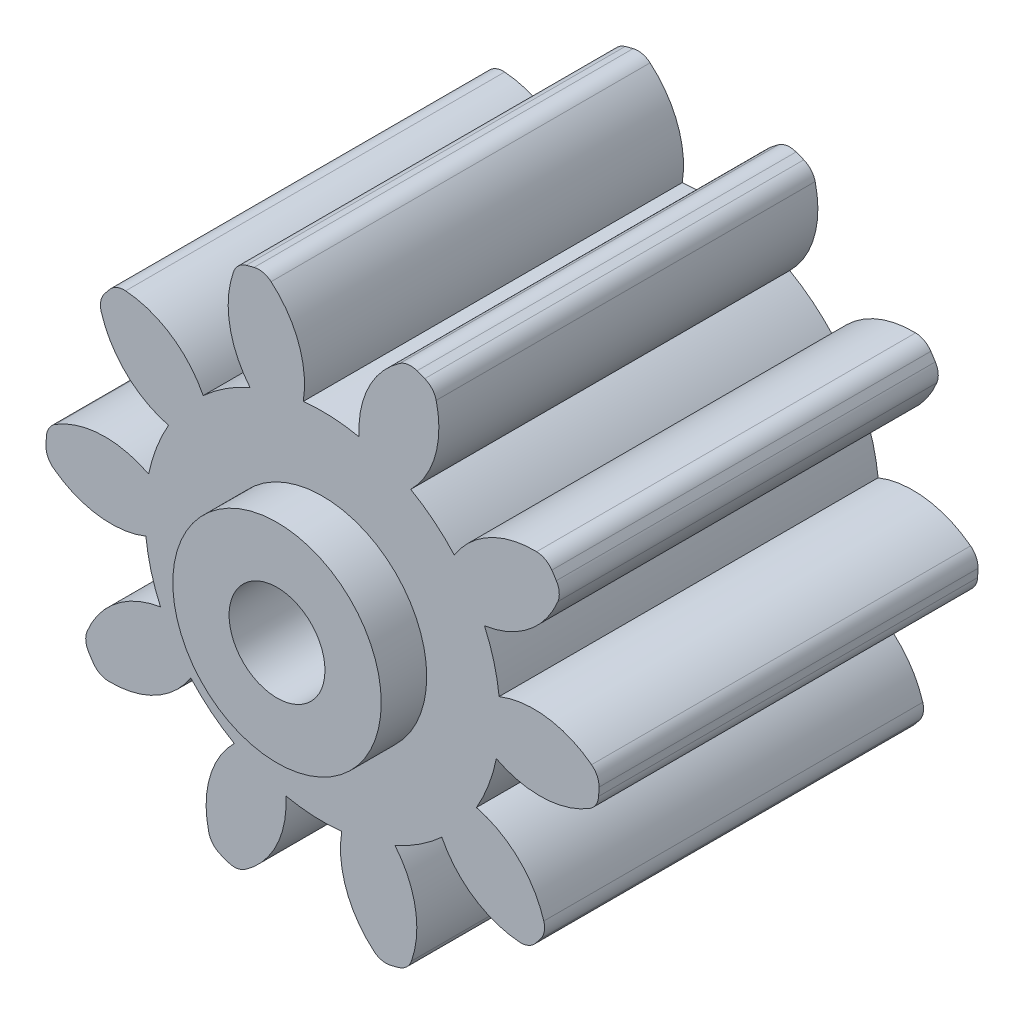
from build123d import *

# Parameters (mm, degrees)
SKETCH_1_R               = 1.265
EXTRUDE_1_DEPTH          = 10
SKETCH_2_R               = 2.75
SKETCH_2_R_2             = 1.265
EXTRUDE_2_DEPTH          = 1.2
SKETCH_3_R               = 10.210079725
SKETCH_3_R_2             = 7.3
CUT_EXTRUDE_2_DEPTH      = 16.316956182
FILLET_1_R               = 0.5
PATTERN_CIRCULAR_2_DEPTH = 10


# Read off the part's stored shape, not the designer's step: Круговой массив2
with BuildPart() as part:
    # Эскиз1 → Бобышка-Вытянуть1 (new body)
    with BuildSketch(Plane.XY):
        with BuildLine():
            ThreePointArc((-3.148803906, 3.471068454), (-4.227852242, 4.566214035), (-5.743712894, 4.822837566))
            ThreePointArc((-5.743712894, 4.822837566), (-5.841480421, 4.703945843), (-5.936787387, 4.583072716))
            ThreePointArc((-5.936787387, 4.583072716), (-5.362797198, 3.156810321), (-4.062728379, 2.336133637))
            ThreePointArc((-4.062728379, 2.336133637), (-4.379801209, 1.667520202), (-4.587678719, 0.95733287))
            ThreePointArc((-4.587678719, 0.95733287), (-6.104357582, 1.209075557), (-7.481554138, 0.525687819))
            ThreePointArc((-7.481554138, 0.525687819), (-7.490766927, 0.372036085), (-7.496824441, 0.218227641))
            ThreePointArc((-7.496824441, 0.218227641), (-6.194120622, -0.598259906), (-4.659961201, -0.498040012))
            ThreePointArc((-4.659961201, -0.498040012), (-4.523477392, -1.225330377), (-4.274216191, -1.922071332))
            ThreePointArc((-4.274216191, -1.922071332), (-5.649205805, -2.609888688), (-6.361695989, -3.972256807))
            ThreePointArc((-6.361695989, -3.972256807), (-6.278835069, -4.101978813), (-6.193329365, -4.229972975))
            ThreePointArc((-6.193329365, -4.229972975), (-4.659500498, -4.124815183), (-3.477247231, -3.141979304))
            ThreePointArc((-3.477247231, -3.141979304), (-2.939338959, -3.650146399), (-2.328148353, -4.067309614))
            ThreePointArc((-2.328148353, -4.067309614), (-3.03624942, -5.431964161), (-2.811886199, -6.952934345))
            ThreePointArc((-2.811886199, -6.952934345), (-2.668601624, -7.009177225), (-2.524192976, -7.062467686))
            ThreePointArc((-2.524192976, -7.062467686), (-1.345109555, -6.075831258), (-0.966343005, -4.585789294))
            ThreePointArc((-0.966343005, -4.585789294), (-0.232472948, -4.68073056), (0.507193024, -4.658973866))
            ThreePointArc((0.507193024, -4.658973866), (0.736451045, -6.179213951), (1.811968547, -7.277827285))
            ThreePointArc((1.811968547, -7.277827285), (1.960946938, -7.239108171), (2.109099336, -7.197339786))
            ThreePointArc((2.109099336, -7.197339786), (2.483067519, -5.706086302), (1.913671403, -4.277983638))
            ThreePointArc((1.913671403, -4.277983638), (2.563189827, -3.92343474), (3.148803906, -3.471068454))
            ThreePointArc((3.148803906, -3.471068454), (4.227852242, -4.566214035), (5.743712894, -4.822837566))
            ThreePointArc((5.743712894, -4.822837566), (5.841480421, -4.703945843), (5.936787387, -4.583072716))
            ThreePointArc((5.936787387, -4.583072716), (5.362797198, -3.156810321), (4.062728379, -2.336133637))
            ThreePointArc((4.062728379, -2.336133637), (4.379801209, -1.667520202), (4.587678719, -0.95733287))
            ThreePointArc((4.587678719, -0.95733287), (6.104357582, -1.209075557), (7.481554138, -0.525687819))
            ThreePointArc((7.481554138, -0.525687819), (7.490766927, -0.372036085), (7.496824441, -0.218227641))
            ThreePointArc((7.496824441, -0.218227641), (6.194120622, 0.598259906), (4.659961201, 0.498040012))
            ThreePointArc((4.659961201, 0.498040012), (4.523477392, 1.225330377), (4.274216191, 1.922071332))
            ThreePointArc((4.274216191, 1.922071332), (5.649205805, 2.609888688), (6.361695989, 3.972256807))
            ThreePointArc((6.361695989, 3.972256807), (6.278835069, 4.101978813), (6.193329365, 4.229972975))
            ThreePointArc((6.193329365, 4.229972975), (4.659500498, 4.124815183), (3.477247231, 3.141979304))
            ThreePointArc((3.477247231, 3.141979304), (2.939338959, 3.650146399), (2.328148353, 4.067309614))
            ThreePointArc((2.328148353, 4.067309614), (3.03624942, 5.431964161), (2.811886199, 6.952934345))
            ThreePointArc((2.811886199, 6.952934345), (2.668601624, 7.009177225), (2.524192976, 7.062467686))
            ThreePointArc((2.524192976, 7.062467686), (1.345109555, 6.075831258), (0.966343005, 4.585789294))
            ThreePointArc((0.966343005, 4.585789294), (0.232472948, 4.68073056), (-0.507193024, 4.658973866))
            ThreePointArc((-0.507193024, 4.658973866), (-0.736451045, 6.179213951), (-1.811968547, 7.277827285))
            ThreePointArc((-1.811968547, 7.277827285), (-1.960946938, 7.239108171), (-2.109099336, 7.197339786))
            ThreePointArc((-2.109099336, 7.197339786), (-2.483067519, 5.706086302), (-1.913671403, 4.277983638))
            ThreePointArc((-1.913671403, 4.277983638), (-2.563189827, 3.92343474), (-3.148803906, 3.471068454))
        make_face()
        Circle(SKETCH_1_R, mode=Mode.SUBTRACT)
    extrude(amount=EXTRUDE_1_DEPTH)

    # Эскиз2 → Бобышка-Вытянуть2 (add)
    with BuildSketch(Plane.XY.offset(10)):
        Circle(SKETCH_2_R)
        Circle(SKETCH_2_R_2, mode=Mode.SUBTRACT)
    extrude(amount=EXTRUDE_2_DEPTH)

    # Эскиз3 → Вырез-Вытянуть2 (cut, through all)
    with BuildSketch(Plane(origin=(0, 0, 0), x_dir=(-1, 0, 0), z_dir=(0, 0, -1))):
        Circle(SKETCH_3_R)
        Circle(SKETCH_3_R_2, mode=Mode.SUBTRACT)
    extrude(amount=-CUT_EXTRUDE_2_DEPTH, mode=Mode.SUBTRACT)

    # Скругление1
    fillet_1_edges = [part.edges().sort_by_distance(p)[0] for p in [
        (-2.246892365, 6.945608303, 5),
        (-1.565958675, 7.13006125, 5),
    ]]
    fillet(fillet_1_edges, radius=FILLET_1_R)

    # Круговой массив2 outline → Круговой массив2 (cut)
    with BuildSketch(Plane.XY):
        with BuildLine():
            ThreePointArc((-5.838293306, 4.042408612), (-5.850561559, 4.278183981), (-5.753278974, 4.493304024))
            ThreePointArc((-5.753278974, 4.493304024), (-5.827604273, 4.396479095), (-5.900300237, 4.298424958))
            ThreePointArc((-5.900300237, 4.298424958), (-5.872671085, 4.169599529), (-5.838293306, 4.042408612))
        make_face()
        with BuildLine():
            ThreePointArc((-5.457832031, 4.847893307), (-5.538127486, 4.755958783), (-5.61687454, 4.662694543))
            ThreePointArc((-5.61687454, 4.662694543), (-5.427449488, 4.803615386), (-5.19448163, 4.841910441))
            ThreePointArc((-5.19448163, 4.841910441), (-5.326077976, 4.84837285), (-5.457832031, 4.847893307))
        make_face()
        with BuildLine():
            ThreePointArc((-7.099346669, -0.161285439), (-7.247857179, 0.022249743), (-7.295598302, 0.253466783))
            ThreePointArc((-7.295598302, 0.253466783), (-7.298816468, 0.131446456), (-7.299993962, 0.009389377))
            ThreePointArc((-7.299993962, 0.009389377), (-7.201919821, -0.078592576), (-7.099346669, -0.161285439))
        make_face()
        with BuildLine():
            ThreePointArc((-7.264999056, 0.713994895), (-7.275921686, 0.592421818), (-7.284810046, 0.470683106))
            ThreePointArc((-7.284810046, 0.470683106), (-7.214393154, 0.696031715), (-7.048427465, 0.863948137))
            ThreePointArc((-7.048427465, 0.863948137), (-7.158689654, 0.791825944), (-7.264999056, 0.713994895))
        make_face()
        with BuildLine():
            ThreePointArc((-5.648690902, -4.303373934), (-5.876717701, -4.24218314), (-6.051247048, -4.083186154))
            ThreePointArc((-6.051247048, -4.083186154), (-5.982128849, -4.183794263), (-5.911338111, -4.283232627))
            ThreePointArc((-5.911338111, -4.283232627), (-5.78027997, -4.296764989), (-5.648690902, -4.303373934))
        make_face()
        with BuildLine():
            ThreePointArc((-6.29718337, -3.692625299), (-6.234561102, -3.797400146), (-6.170195716, -3.90111328))
            ThreePointArc((-6.170195716, -3.90111328), (-6.245683843, -3.677412414), (-6.210113576, -3.444012991))
            ThreePointArc((-6.210113576, -3.444012991), (-6.2569252, -3.567171559), (-6.29718337, -3.692625299))
        make_face()
        with BuildLine():
            ThreePointArc((-2.040427202, -6.801719852), (-2.260871804, -6.88624625), (-2.495525095, -6.860200762))
            ThreePointArc((-2.495525095, -6.860200762), (-2.380471335, -6.900967774), (-2.264752021, -6.939805349))
            ThreePointArc((-2.264752021, -6.939805349), (-2.150769635, -6.873719217), (-2.040427202, -6.801719852))
        make_face()
        with BuildLine():
            ThreePointArc((-2.92405767, -6.688788137), (-2.811810081, -6.736744322), (-2.69877634, -6.782816986))
            ThreePointArc((-2.69877634, -6.782816986), (-2.891335587, -6.646209992), (-2.999747375, -6.436478214))
            ThreePointArc((-2.999747375, -6.436478214), (-2.965227985, -6.563630771), (-2.92405767, -6.688788137))
        make_face()
        with BuildLine():
            ThreePointArc((2.347210337, -6.702039969), (2.218550278, -6.899997348), (2.013402624, -7.016851849))
            ThreePointArc((2.013402624, -7.016851849), (2.130445319, -6.982206151), (2.246892365, -6.945608303))
            ThreePointArc((2.246892365, -6.945608303), (2.300261598, -6.825146334), (2.347210337, -6.702039969))
        make_face()
        with BuildLine():
            ThreePointArc((1.565958675, -7.13006125), (1.684956821, -7.102881142), (1.80348387, -7.073715143))
            ThreePointArc((1.80348387, -7.073715143), (1.56740459, -7.076381249), (1.356420365, -6.970427527))
            ThreePointArc((1.356420365, -6.970427527), (1.459085537, -7.053006118), (1.565958675, -7.13006125))
        make_face()
        with BuildLine():
            ThreePointArc((5.838293306, -4.042408612), (5.850561559, -4.278183981), (5.753278974, -4.493304024))
            ThreePointArc((5.753278974, -4.493304024), (5.827604273, -4.396479095), (5.900300237, -4.298424958))
            ThreePointArc((5.900300237, -4.298424958), (5.872671085, -4.169599529), (5.838293306, -4.042408612))
        make_face()
        with BuildLine():
            ThreePointArc((5.457832031, -4.847893307), (5.538127486, -4.755958783), (5.61687454, -4.662694543))
            ThreePointArc((5.61687454, -4.662694543), (5.427449488, -4.803615386), (5.19448163, -4.841910441))
            ThreePointArc((5.19448163, -4.841910441), (5.326077976, -4.84837285), (5.457832031, -4.847893307))
        make_face()
        with BuildLine():
            ThreePointArc((7.099346669, 0.161285439), (7.247857179, -0.022249743), (7.295598302, -0.253466783))
            ThreePointArc((7.295598302, -0.253466783), (7.298816468, -0.131446456), (7.299993962, -0.009389377))
            ThreePointArc((7.299993962, -0.009389377), (7.201919821, 0.078592576), (7.099346669, 0.161285439))
        make_face()
        with BuildLine():
            ThreePointArc((7.264999056, -0.713994895), (7.275921686, -0.592421818), (7.284810046, -0.470683106))
            ThreePointArc((7.284810046, -0.470683106), (7.214393154, -0.696031715), (7.048427465, -0.863948137))
            ThreePointArc((7.048427465, -0.863948137), (7.158689654, -0.791825944), (7.264999056, -0.713994895))
        make_face()
        with BuildLine():
            ThreePointArc((5.648690902, 4.303373934), (5.876717701, 4.24218314), (6.051247048, 4.083186154))
            ThreePointArc((6.051247048, 4.083186154), (5.982128849, 4.183794263), (5.911338111, 4.283232627))
            ThreePointArc((5.911338111, 4.283232627), (5.78027997, 4.296764989), (5.648690902, 4.303373934))
        make_face()
        with BuildLine():
            ThreePointArc((6.29718337, 3.692625299), (6.234561102, 3.797400146), (6.170195716, 3.90111328))
            ThreePointArc((6.170195716, 3.90111328), (6.245683843, 3.677412414), (6.210113576, 3.444012991))
            ThreePointArc((6.210113576, 3.444012991), (6.2569252, 3.567171559), (6.29718337, 3.692625299))
        make_face()
        with BuildLine():
            ThreePointArc((2.040427202, 6.801719852), (2.260871804, 6.88624625), (2.495525095, 6.860200762))
            ThreePointArc((2.495525095, 6.860200762), (2.380471335, 6.900967774), (2.264752021, 6.939805349))
            ThreePointArc((2.264752021, 6.939805349), (2.150769635, 6.873719217), (2.040427202, 6.801719852))
        make_face()
        with BuildLine():
            ThreePointArc((2.92405767, 6.688788137), (2.811810081, 6.736744322), (2.69877634, 6.782816986))
            ThreePointArc((2.69877634, 6.782816986), (2.891335587, 6.646209992), (2.999747375, 6.436478214))
            ThreePointArc((2.999747375, 6.436478214), (2.965227985, 6.563630771), (2.92405767, 6.688788137))
        make_face()
    extrude(amount=PATTERN_CIRCULAR_2_DEPTH, mode=Mode.SUBTRACT)


solid = part.part
